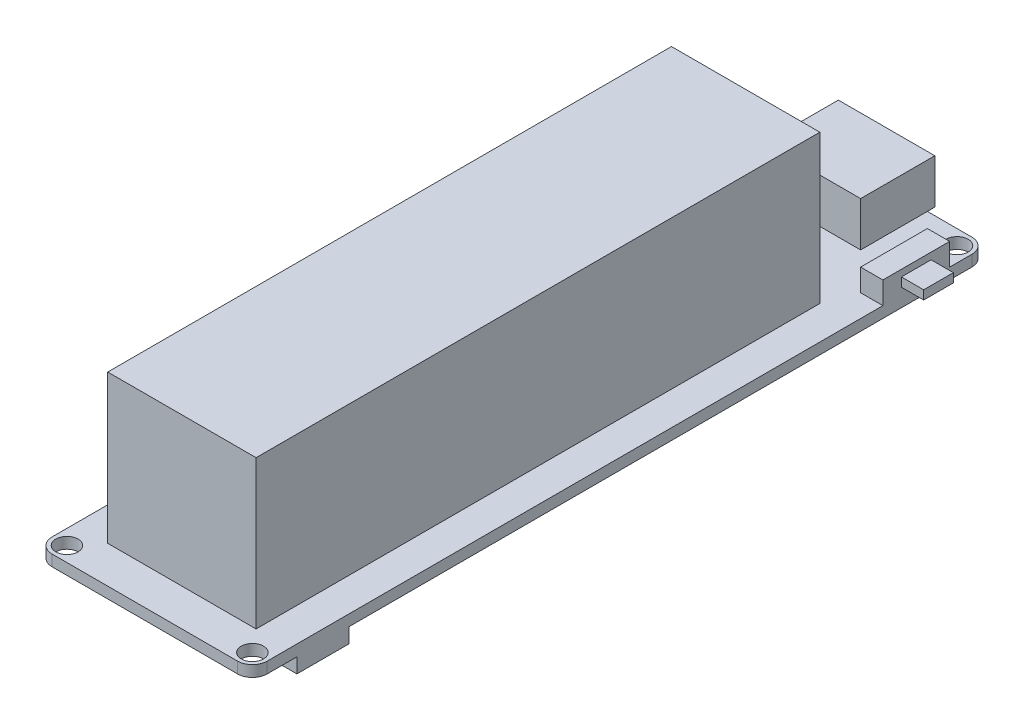
from build123d import *

# Parameters (mm, degrees)
SKETCH1_R            = 1.5
BOSS_EXTRUDE1_DEPTH  = 1.5
SKETCH2_W            = 20
SKETCH2_H            = 76
BOSS_EXTRUDE2_DEPTH  = 20
SKETCH3_W            = 13
SKETCH3_H            = 10
BOSS_EXTRUDE3_DEPTH  = 6
SKETCH3_3_W          = 5
SKETCH3_3_H          = 7
BOSS_EXTRUDE4_DEPTH  = 4
SKETCH3_4_W          = 3
SKETCH3_4_H          = 9
BOSS_EXTRUDE5_DEPTH  = 3
SKETCH4_W            = 3
SKETCH4_H            = 2
BOSS_EXTRUDE6_DEPTH  = 1.2
SKETCH5_W            = 4
SKETCH5_H            = 1.2
BOSS_EXTRUDE7_DEPTH  = 3
SKETCH6_W            = 1.1
SKETCH6_H            = 0.9
BOSS_EXTRUDE8_DEPTH  = 0.2
SKETCH6_3_W          = 6.5
SKETCH6_3_H          = 6.5
BOSS_EXTRUDE9_DEPTH  = 5
SKETCH6_4_W          = 6
SKETCH6_4_H          = 9
BOSS_EXTRUDE10_DEPTH = 3
SKETCH6_5_W          = 5
SKETCH6_5_H          = 7
BOSS_EXTRUDE11_DEPTH = 2


with BuildPart() as part:
    # Sketch1 → Boss-Extrude1 (new body)
    with BuildSketch(Plane(origin=(0, 0, 0), x_dir=(1, 0, 0), z_dir=(0, 1, 0))):
        with BuildLine():
            Line((12.5, -49.5), (-12.5, -49.5))
            ThreePointArc((-12.5, -49.5), (-13.914213562, -48.914213562), (-14.5, -47.5))
            Line((-14.5, -47.5), (-14.5, 47.5))
            ThreePointArc((-14.5, 47.5), (-13.914213562, 48.914213562), (-12.5, 49.5))
            Line((-12.5, 49.5), (12.5, 49.5))
            ThreePointArc((12.5, 49.5), (13.914213562, 48.914213562), (14.5, 47.5))
            Line((14.5, 47.5), (14.5, -47.5))
            ThreePointArc((14.5, -47.5), (13.914213562, -48.914213562), (12.5, -49.5))
        make_face()
        with Locations((-12.5, 47.5)):
            Circle(SKETCH1_R, mode=Mode.SUBTRACT)
        with Locations((12.5, 47.5)):
            Circle(SKETCH1_R, mode=Mode.SUBTRACT)
        with Locations((-12.5, -47.5)):
            Circle(SKETCH1_R, mode=Mode.SUBTRACT)
        with Locations((12.5, -47.5)):
            Circle(SKETCH1_R, mode=Mode.SUBTRACT)
    extrude(amount=BOSS_EXTRUDE1_DEPTH)

    # Sketch2 → Boss-Extrude2 (add)
    with BuildSketch(Plane(origin=(0, 1.5, 0), x_dir=(1, 0, 0), z_dir=(0, 1, 0))):
        with Locations((0, -6.5)):
            Rectangle(SKETCH2_W, SKETCH2_H)
    extrude(amount=BOSS_EXTRUDE2_DEPTH)

    # Sketch3 → Boss-Extrude3 (add)
    with BuildSketch(Plane(origin=(0, 1.5, 0), x_dir=(1, 0, 0), z_dir=(0, 1, 0))):
        with Locations((0, 45.5)):
            Rectangle(SKETCH3_W, SKETCH3_H)
    extrude(amount=BOSS_EXTRUDE3_DEPTH)

    # Sketch3<3> → Boss-Extrude4 (add)
    with BuildSketch(Plane(origin=(0, 1.5, 0), x_dir=(1, 0, 0), z_dir=(0, 1, 0))):
        with Locations((-12, 37)):
            Rectangle(SKETCH3_3_W, SKETCH3_3_H)
    extrude(amount=BOSS_EXTRUDE4_DEPTH)

    # Sketch3<4> → Boss-Extrude5 (add)
    with BuildSketch(Plane(origin=(0, 1.5, 0), x_dir=(1, 0, 0), z_dir=(0, 1, 0))):
        with Locations((13, 40)):
            Rectangle(SKETCH3_4_W, SKETCH3_4_H)
    extrude(amount=BOSS_EXTRUDE5_DEPTH)

    # Sketch4 → Boss-Extrude6 (add)
    with BuildSketch(Plane.ZY.offset(14.5)):
        with Locations((-37, 3.5)):
            Rectangle(SKETCH4_W, SKETCH4_H)
    extrude(amount=BOSS_EXTRUDE6_DEPTH)

    # Sketch5 → Boss-Extrude7 (add)
    with BuildSketch(Plane(origin=(14.5, 0, 0), x_dir=(0, 0, -1), z_dir=(1, 0, 0))):
        with Locations((40, 3)):
            Rectangle(SKETCH5_W, SKETCH5_H)
    extrude(amount=BOSS_EXTRUDE7_DEPTH)

    # Sketch6 → Boss-Extrude8 (add)
    with BuildSketch(Plane.XZ):
        with Locations((-8.95, -30.05)):
            Rectangle(SKETCH6_W, SKETCH6_H)
        with Locations((-8.95, -26.05)):
            Rectangle(SKETCH6_W, SKETCH6_H)
        with Locations((-8.95, -22.05)):
            Rectangle(SKETCH6_W, SKETCH6_H)
        with Locations((-8.95, -18.05)):
            Rectangle(SKETCH6_W, SKETCH6_H)
        with Locations((-8.95, -14.05)):
            Rectangle(SKETCH6_W, SKETCH6_H)
    extrude(amount=BOSS_EXTRUDE8_DEPTH)

    # Sketch6<3> → Boss-Extrude9 (add)
    with BuildSketch(Plane.XZ):
        with Locations((0.25, -4.75)):
            Rectangle(SKETCH6_3_W, SKETCH6_3_H)
    extrude(amount=BOSS_EXTRUDE9_DEPTH)

    # Sketch6<4> → Boss-Extrude10 (add)
    with BuildSketch(Plane.XZ):
        with Locations((-11.5, 26.5)):
            Rectangle(SKETCH6_4_W, SKETCH6_4_H)
    extrude(amount=BOSS_EXTRUDE10_DEPTH)

    # Sketch6<5> → Boss-Extrude11 (add)
    with BuildSketch(Plane.XZ):
        with Locations((12, 40)):
            Rectangle(SKETCH6_5_W, SKETCH6_5_H)
    extrude(amount=BOSS_EXTRUDE11_DEPTH)


solid = part.part
